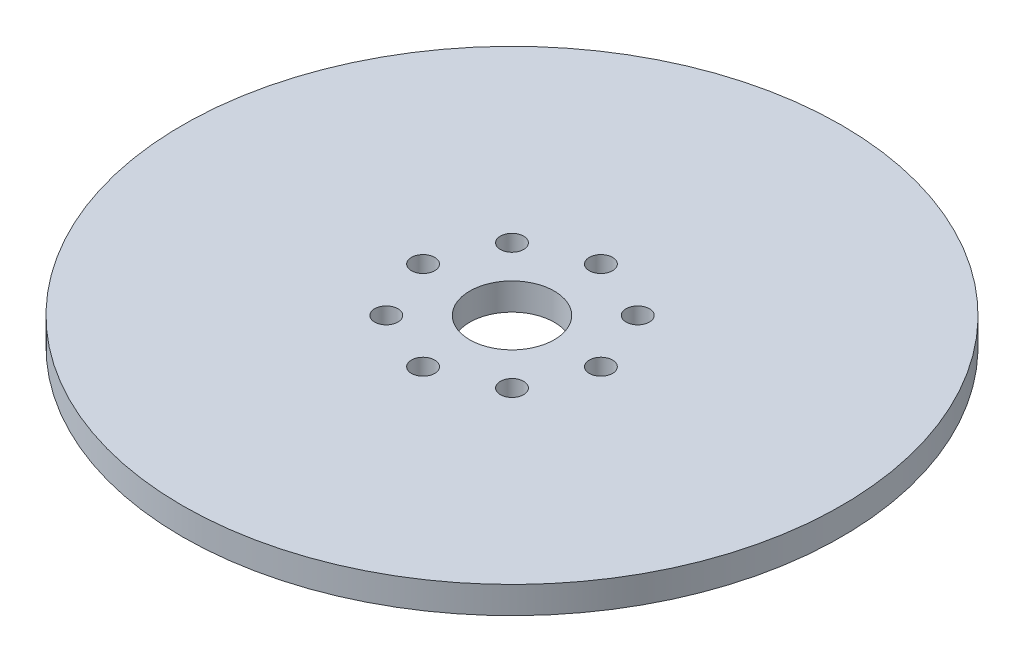
from build123d import *

# Parameters (mm, degrees)
SKETCH1_R           = 97.5
BOSS_EXTRUDE1_DEPTH = 8
SKETCH2_R           = 12.5
CUT_EXTRUDE1_DEPTH  = 139.117703427
SKETCH3_R           = 3.441916601
CUT_EXTRUDE2_DEPTH  = 5.339201693
CIRPATTERN1_COUNT   = 8


with BuildPart() as part:
    # Sketch1 → Boss-Extrude1 (new body)
    with BuildSketch(Plane(origin=(0, 0, 0), x_dir=(1, 0, 0), z_dir=(0, 1, 0))):
        Circle(SKETCH1_R)
    extrude(amount=BOSS_EXTRUDE1_DEPTH)

    # Sketch2 → Cut-Extrude1 (cut, through all)
    with BuildSketch(Plane(origin=(0, 0, 0), x_dir=(1, 0, 0), z_dir=(0, 1, 0))):
        Circle(SKETCH2_R)
    extrude(amount=CUT_EXTRUDE1_DEPTH, mode=Mode.SUBTRACT)

    # Sketch3 → Cut-Extrude2 (cut)
    with BuildSketch(Plane(origin=(0, 8, 0), x_dir=(1, 0, 0), z_dir=(0, 1, 0))):
        with Locations((-26.305499443, 0)):
            Circle(SKETCH3_R)
    cut_extrude2 = extrude(amount=-CUT_EXTRUDE2_DEPTH, mode=Mode.SUBTRACT)

    # CirPattern1: Cut-Extrude2 ×8 about axis
    cirpattern1_axis = Axis((0, 0, 0), (0, 1, 0))
    for i in range(1, CIRPATTERN1_COUNT):
        add(cut_extrude2.rotate(cirpattern1_axis, i * 360 / CIRPATTERN1_COUNT), mode=Mode.SUBTRACT)


solid = part.part
